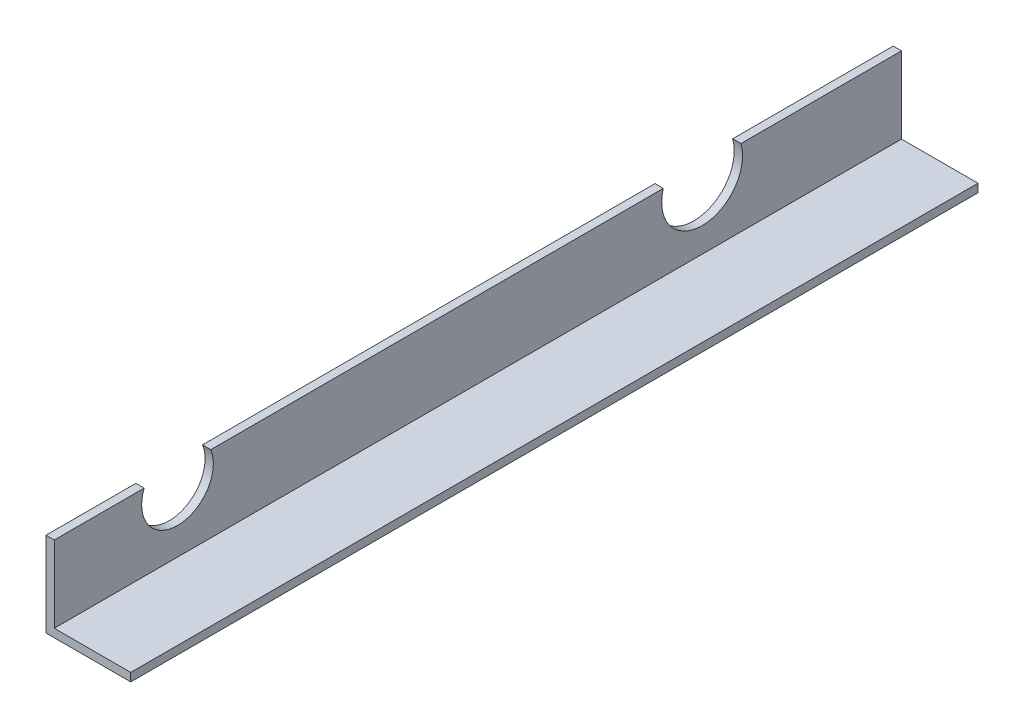
from build123d import *

# Parameters (mm, degrees)
SALIENTE_EXTRUIR1_DEPTH           = 325
TALADRO3_DEPTH                    = 6.35
TALADRO_DE_MARGEN_PARA_M561_D     = 62
TALADRO_DE_MARGEN_PARA_M561_DEPTH = 287.94
TALADRO_DE_MARGEN_PARA_M561_TIP   = 18.62667919


# Read off the part's stored shape, not the designer's step: Taladro3
with BuildPart() as part:
    # Croquis1 → Saliente-Extruir1 (new, symmetric)
    with BuildSketch(Plane.XY):
        Polygon((0, 0), (0, 65), (6.35, 65), (6.35, 6.35), (65, 6.35), (65, 0), align=None)
    extrude(amount=SALIENTE_EXTRUIR1_DEPTH, both=True)

    # Taladro3 outline → Taladro3 (cut)
    with BuildSketch(Plane.YZ):
        with BuildLine():
            Line((65, 204.912035309), (65, 256.022124888))
            ThreePointArc((65, 256.022124888), (27.341767585, 230.467080098), (65, 204.912035309))
        make_face()
    extrude(amount=TALADRO3_DEPTH, mode=Mode.SUBTRACT)

    # Taladro de margen para M561
    with Locations(Plane(origin=(6.35, 55.113874636, 289.004791986), x_dir=(0, 1, 0), z_dir=(1, 0, 0))):
        with Locations((1.236125364, -461.004791986)):
            Hole(TALADRO_DE_MARGEN_PARA_M561_D / 2, depth=TALADRO_DE_MARGEN_PARA_M561_DEPTH)
            with Locations((0, 0, -(TALADRO_DE_MARGEN_PARA_M561_DEPTH + TALADRO_DE_MARGEN_PARA_M561_TIP / 2))):  # 118° drill point
                Cone(0, TALADRO_DE_MARGEN_PARA_M561_D / 2, TALADRO_DE_MARGEN_PARA_M561_TIP, mode=Mode.SUBTRACT)


solid = part.part
